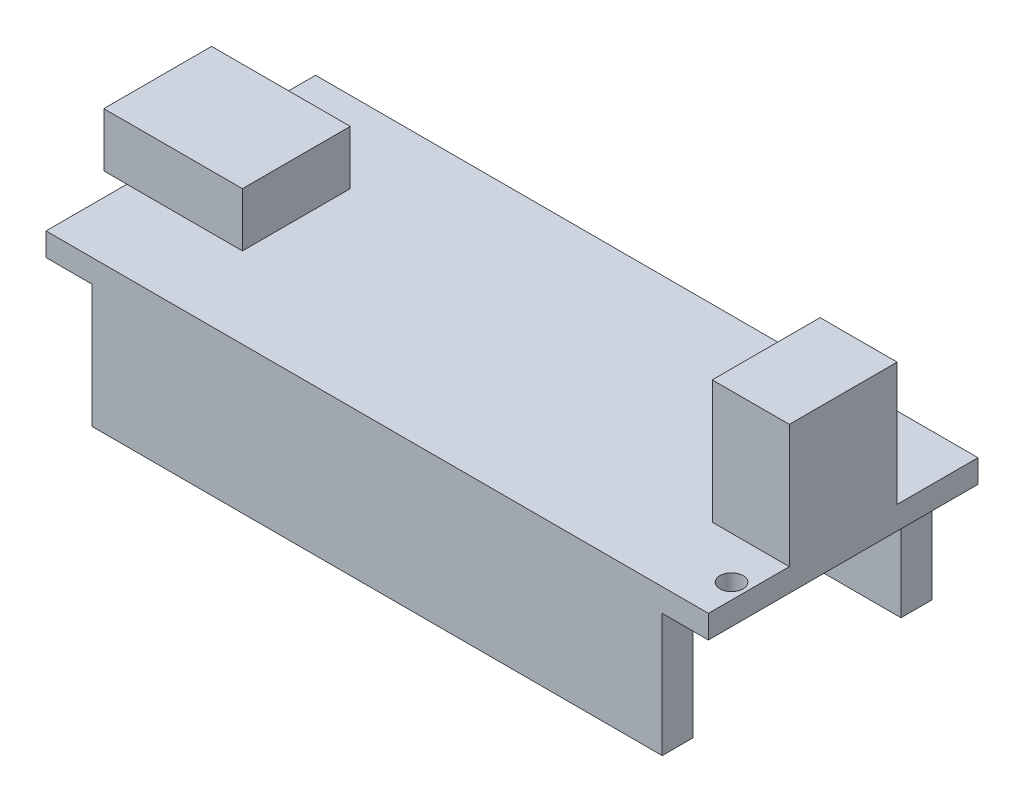
from build123d import *

# Parameters (mm, degrees)
SKETCH1_W           = 43
SKETCH1_H           = 17.5
SKETCH1_R           = 0.75
BOSS_EXTRUDE1_DEPTH = 1.5
SKETCH2_W           = 9
SKETCH2_H           = 7
BOSS_EXTRUDE2_DEPTH = 3.5
SKETCH3_W           = 5
SKETCH3_H           = 7
BOSS_EXTRUDE3_DEPTH = 8
SKETCH4_W           = 37
SKETCH4_H           = 2
BOSS_EXTRUDE4_DEPTH = 8


with BuildPart() as part:
    # Sketch1 → Boss-Extrude1 (new body)
    with BuildSketch(Plane(origin=(0, 0, 0), x_dir=(1, 0, 0), z_dir=(0, 1, 0))):
        Rectangle(SKETCH1_W, SKETCH1_H)
        with Locations((20.5, -6.25)):
            Circle(SKETCH1_R, mode=Mode.SUBTRACT)
    extrude(amount=BOSS_EXTRUDE1_DEPTH)

    # Sketch2 → Boss-Extrude2 (add)
    with BuildSketch(Plane(origin=(0, 1.5, 0), x_dir=(1, 0, 0), z_dir=(0, 1, 0))):
        with Locations((-18.5, 0)):
            Rectangle(SKETCH2_W, SKETCH2_H)
    extrude(amount=BOSS_EXTRUDE2_DEPTH)

    # Sketch3 → Boss-Extrude3 (add)
    with BuildSketch(Plane(origin=(0, 1.5, 0), x_dir=(1, 0, 0), z_dir=(0, 1, 0))):
        with Locations((19, 0)):
            Rectangle(SKETCH3_W, SKETCH3_H)
    extrude(amount=BOSS_EXTRUDE3_DEPTH)

    # Sketch4 → Boss-Extrude4 (add)
    with BuildSketch(Plane.XZ):
        with Locations((0, 7.75)):
            Rectangle(SKETCH4_W, SKETCH4_H)
        with Locations((0, -7.75)):
            Rectangle(SKETCH4_W, SKETCH4_H)
    extrude(amount=BOSS_EXTRUDE4_DEPTH)


solid = part.part
